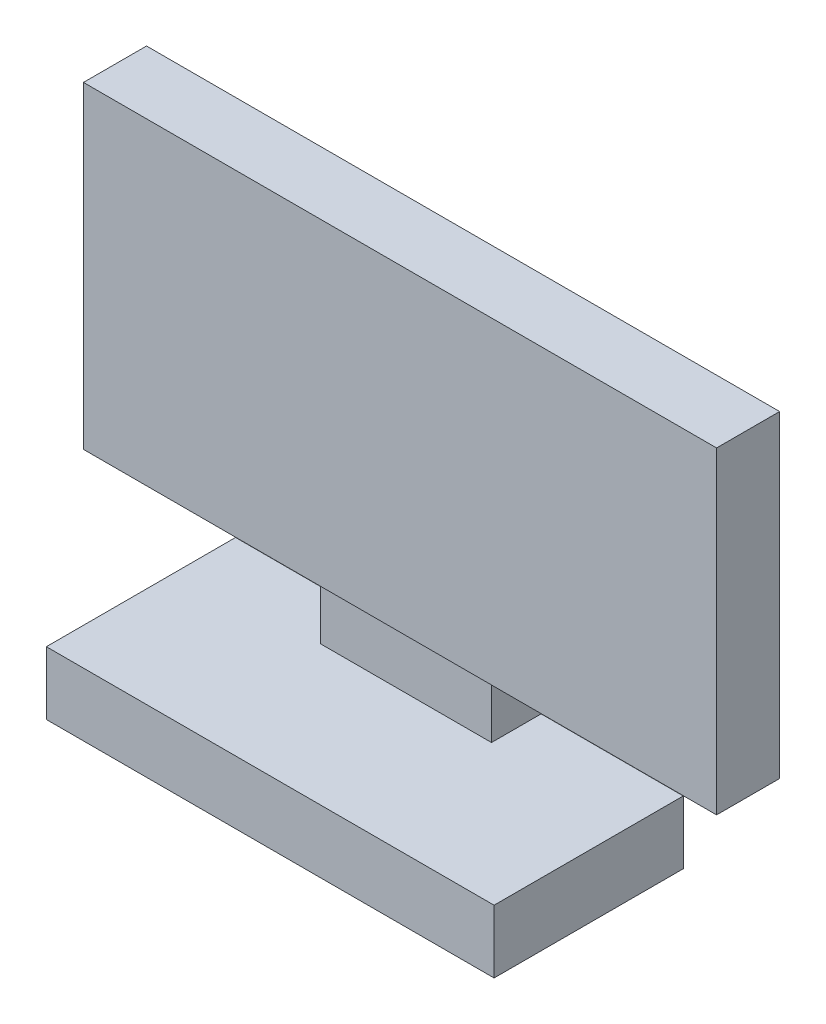
from build123d import *

# Parameters (mm, degrees)
SKETCH1_W           = 35.5
SKETCH1_H           = 15
BOSS_EXTRUDE7_DEPTH = 5
SKETCH5_W           = 13.567085075
SKETCH5_H           = 3.932792286
BOSS_EXTRUDE8_DEPTH = 5
SKETCH6_W           = 50.2
SKETCH6_H           = 5
BOSS_EXTRUDE9_DEPTH = 25.2


with BuildPart() as part:
    # Sketch1 → Boss-Extrude7 (new body)
    with BuildSketch(Plane(origin=(0, 0, 0), x_dir=(1, 0, 0), z_dir=(0, 1, 0))):
        with Locations((32.254129859, 13.775388257)):
            Rectangle(SKETCH1_W, SKETCH1_H)
    extrude(amount=BOSS_EXTRUDE7_DEPTH)

    # Sketch5 → Boss-Extrude8 (add)
    with BuildSketch(Plane(origin=(0, 5, 0), x_dir=(1, 0, 0), z_dir=(0, 1, 0))):
        with Locations((31.950040022, 19.308992114)):
            Rectangle(SKETCH5_W, SKETCH5_H)
    extrude(amount=BOSS_EXTRUDE8_DEPTH)

    # Sketch6 → Boss-Extrude9 (add)
    with BuildSketch(Plane(origin=(1.124638213, 10, 0), x_dir=(1, 0, 0), z_dir=(0, 1, 0))):
        with Locations((31.402213384, 18.794771585)):
            Rectangle(SKETCH6_W, SKETCH6_H)
    extrude(amount=BOSS_EXTRUDE9_DEPTH)


solid = part.part
